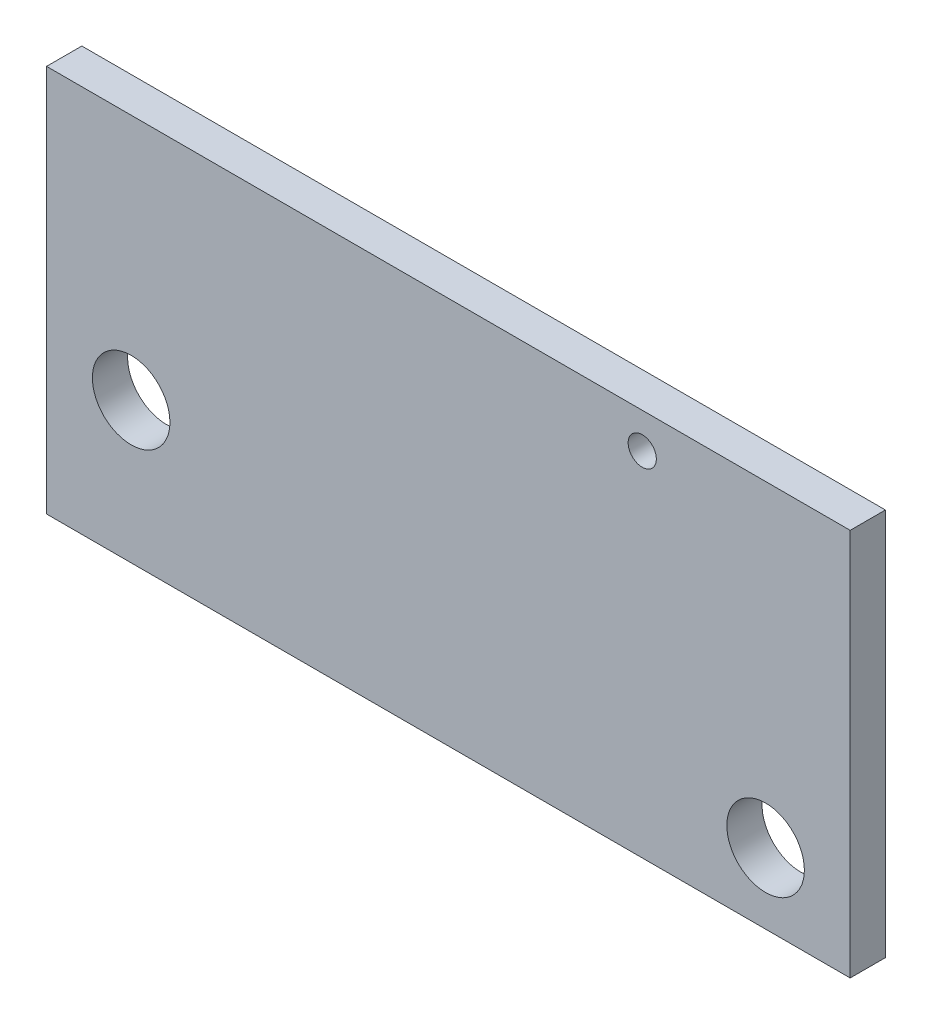
from build123d import *

# Parameters (mm, degrees)
SKETCH1_W           = 228
SKETCH1_H           = 110
SKETCH1_R           = 11
SKETCH1_R_2         = 4
BOSS_EXTRUDE1_DEPTH = 10


with BuildPart() as part:
    # Sketch1 → Boss-Extrude1 (new body)
    with BuildSketch(Plane.XY):
        with Locations((114, 55)):
            Rectangle(SKETCH1_W, SKETCH1_H)
        with Locations((24, 40)):
            Circle(SKETCH1_R, mode=Mode.SUBTRACT)
        with Locations((204, 20)):
            Circle(SKETCH1_R, mode=Mode.SUBTRACT)
        with Locations((169, 100)):
            Circle(SKETCH1_R_2, mode=Mode.SUBTRACT)
    extrude(amount=BOSS_EXTRUDE1_DEPTH)


solid = part.part
